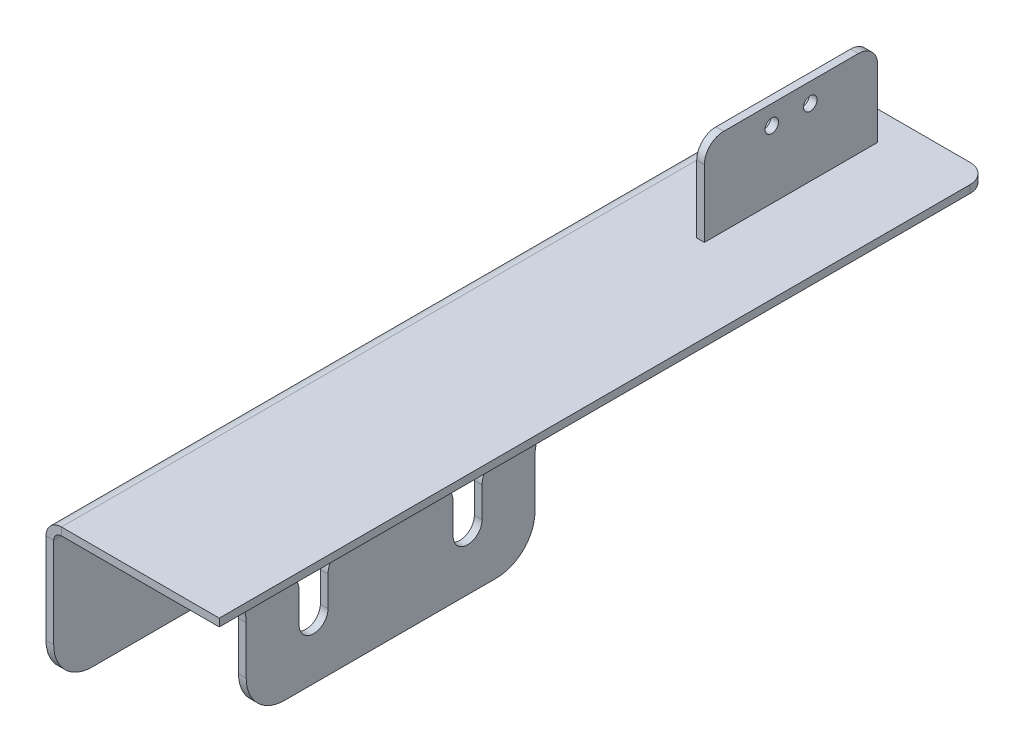
from build123d import *

# Parameters (mm, degrees)
SM_BASE_FLANGE_1_DEPTH = 400
CUT_EXTRUDE_1_DEPTH    = 10
FILLET_1_R             = 10
SKETCH_7_W             = 150
SKETCH_7_H             = 65
EXTRUDE_1_DEPTH        = 4
SKETCH_8_R             = 6
CUT_EXTRUDE_2_DEPTH    = 10
FILLET_2_R             = 10
FILLET_3_R             = 20
SKETCH_10_W            = 90
SKETCH_10_H            = 45
EXTRUDE_2_DEPTH        = 2
HOLE_WIZARD_7_0_7_1_D  = 7
FILLET_4_R             = 10
FILLET_5_R             = 20


# Sheet-metal steps are written as plain solids
with BuildPart() as part:
    # Sketch 1 → 基体-法兰1 (new body)
    with BuildSketch(Plane.XY):
        with BuildLine():
            Line((0, 0), (0, 67))
            ThreePointArc((0, 67), (2.343145751, 72.656854249), (8, 75))
            Line((8, 75), (90, 75))
            Line((90, 75), (90, 71))
            Line((90, 71), (8, 71))
            ThreePointArc((8, 71), (5.171572875, 69.828427125), (4, 67))
            Line((4, 67), (4, 0))
            Line((4, 0), (0, 0))
        make_face()
    extrude(amount=SM_BASE_FLANGE_1_DEPTH)

    # 草图6 → 切除-拉伸1 (cut)
    with BuildSketch(Plane.ZY):
        Polygon((0, 0), (0, 40), (70, 0), align=None)
    extrude(amount=-CUT_EXTRUDE_1_DEPTH, mode=Mode.SUBTRACT)

    # 圆角1
    fillet_1_edges = [part.edges().sort_by_distance(p)[0] for p in [
        (2, 40, 0),
        (2, 0, 70),
        (90, 73, 0),
    ]]
    fillet(fillet_1_edges, radius=FILLET_1_R)

    # 草图7 → 凸台-拉伸1 (add)
    with BuildSketch(Plane.ZY):
        with Locations((225, -32.5)):
            Rectangle(SKETCH_7_W, SKETCH_7_H)
    extrude(amount=-EXTRUDE_1_DEPTH)

    # 草图8 → 切除-拉伸2 (cut)
    with BuildSketch(Plane.ZY):
        with Locations((225, 45)):
            Circle(SKETCH_8_R)
        with BuildLine():
            Line((192.5, -35), (192.5, -13.540496218))
            ThreePointArc((192.5, -13.540496218), (185, 25), (177.5, -13.540496218))
            Line((177.5, -13.540496218), (177.5, -35))
            ThreePointArc((177.5, -35), (185, -42.5), (192.5, -35))
        make_face()
        with BuildLine():
            Line((257.5, -35), (257.5, -13.540496218))
            ThreePointArc((257.5, -13.540496218), (265, 25), (272.5, -13.540496218))
            Line((272.5, -13.540496218), (272.5, -35))
            ThreePointArc((272.5, -35), (265, -42.5), (257.5, -35))
        make_face()
    extrude(amount=-CUT_EXTRUDE_2_DEPTH, mode=Mode.SUBTRACT)

    # 圆角2
    fillet_2_edges = [part.edges().sort_by_distance(p)[0] for p in [
        (2, -13.540496218, 177.5),
        (2, -13.540496218, 192.5),
        (2, -13.540496218, 257.5),
        (2, -13.540496218, 272.5),
    ]]
    fillet(fillet_2_edges, radius=FILLET_2_R)

    # 圆角3
    fillet_3_edges = [part.edges().sort_by_distance(p)[0] for p in [
        (2, -65, 150),
        (2, 0, 150),
        (2, 0, 300),
        (2, -65, 300),
    ]]
    fillet(fillet_3_edges, radius=FILLET_3_R)

    # 草图10 → 凸台-拉伸2 (add, symmetric)
    with BuildSketch(Plane.ZY.offset(-45)):
        with Locations((60, 97.5)):
            Rectangle(SKETCH_10_W, SKETCH_10_H)
    extrude(amount=EXTRUDE_2_DEPTH, both=True)

    # Ø7.0 (7) 直径孔1 (through all)
    with Locations(Plane.ZY.offset(-43)):
        with Locations((50, 110), (70, 110)):
            Hole(HOLE_WIZARD_7_0_7_1_D / 2)

    # 圆角4
    fillet_4_edges = [part.edges().sort_by_distance(p)[0] for p in [
        (45, 120, 105),
        (45, 120, 15),
    ]]
    fillet(fillet_4_edges, radius=FILLET_4_R)

    # 圆角5
    fillet_5_edges = [part.edges().sort_by_distance(p)[0] for p in [
        (2, 0, 400),
    ]]
    fillet(fillet_5_edges, radius=FILLET_5_R)


solid = part.part
